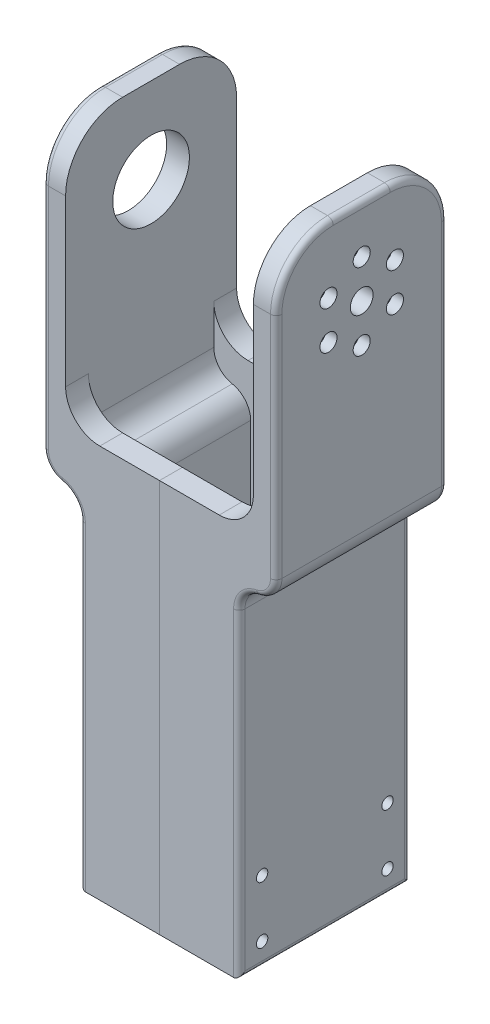
from build123d import *

# Parameters (mm, degrees)
SKETCH_1_W          = 60
SKETCH_1_H          = 100
EXTRUDE_1_DEPTH     = 8
SKETCH_2_R          = 13.45
CUT_EXTRUDE_1_DEPTH = 59.855755878
SKETCH_3_W          = 8
SKETCH_3_H          = 40
EXTRUDE_2_DEPTH     = 65.9
SKETCH_4_W          = 60
SKETCH_4_H          = 100
EXTRUDE_3_DEPTH     = 8
CUT_EXTRUDE_2_REACH = 102.537
SKETCH_10_R         = 4
SKETCH_10_R_2       = 1.6
SKETCH_15_R         = 18
EXTRUDE_4_DEPTH     = 9.8
SKETCH_12_R         = 3
CUT_EXTRUDE_4_DEPTH = 4
CUT_EXTRUDE_7_REACH = 102.537
SKETCH_10_2_R       = 4
SKETCH_10_2_R_2     = 1.6
SKETCH1_W           = 65.9
SKETCH1_H           = 30
CUT_EXTRUDE1_DEPTH  = 114.170711759
SKETCH2_W           = 8
SKETCH2_H           = 120
BOSS_EXTRUDE3_DEPTH = 60
FILLET1_R           = 12
FILLET3_R           = 8
FILLET4_R           = 8
BOSS_EXTRUDE4_REACH = 192.523
SKETCH3_W           = 8
SKETCH3_H           = 128
FILLET5_R           = 20
FILLET6_R           = 2
SKETCH7_R           = 2
CUT_EXTRUDE2_DEPTH  = 8
CUT_EXTRUDE3_START  = -48
SKETCH7_2_R         = 2
CUT_EXTRUDE3_DEPTH  = 8


with BuildPart() as part:
    # 草图1 → 凸台-拉伸1 (new body)
    with BuildSketch(Plane(origin=(0, 0, 0), x_dir=(0, 0, -1), z_dir=(1, 0, 0))):
        Rectangle(SKETCH_1_W, SKETCH_1_H)
    extrude(amount=EXTRUDE_1_DEPTH)

    # 草图2 → 切除-拉伸1 (cut, through all)
    with BuildSketch(Plane(origin=(8, 0, 0), x_dir=(0, 0, -1), z_dir=(1, 0, 0))):
        with Locations((0, 20)):
            Circle(SKETCH_2_R)
    extrude(amount=-CUT_EXTRUDE_1_DEPTH, mode=Mode.SUBTRACT)

    # 草图3 → 凸台-拉伸2 (add)
    with BuildSketch(Plane(origin=(8, 0, 0), x_dir=(0, 0, -1), z_dir=(1, 0, 0))):
        with Locations((-26, -30)):
            Rectangle(SKETCH_3_W, SKETCH_3_H)
        with Locations((26, -30)):
            Rectangle(SKETCH_3_W, SKETCH_3_H)
    extrude(amount=EXTRUDE_2_DEPTH)

    # 草图4 → 凸台-拉伸3 (add)
    with BuildSketch(Plane(origin=(73.9, 0, 0), x_dir=(0, 0, -1), z_dir=(1, 0, 0))):
        Rectangle(SKETCH_4_W, SKETCH_4_H)
    extrude(amount=EXTRUDE_3_DEPTH)

    # 草图10 → 切除-拉伸2 (cut, up to next)
    with BuildSketch(Plane(origin=(81.9, 0, 0), x_dir=(0, 0, -1), z_dir=(1, 0, 0)), mode=Mode.PRIVATE) as cut_extrude_2_sk1:
        with Locations((0, 20)):
            Circle(SKETCH_10_R)
    cut_extrude_2_tool1 = extrude(cut_extrude_2_sk1.sketch, amount=-CUT_EXTRUDE_2_REACH, mode=Mode.PRIVATE) & part.part
    # 草图10 → 切除-拉伸2 (cut, up to next)
    with BuildSketch(Plane(origin=(81.9, 0, 0), x_dir=(0, 0, -1), z_dir=(1, 0, 0)), mode=Mode.PRIVATE) as cut_extrude_2_sk2:
        with Locations((0, 33.5)):
            Circle(SKETCH_10_R_2)
    cut_extrude_2_tool2 = extrude(cut_extrude_2_sk2.sketch, amount=-CUT_EXTRUDE_2_REACH, mode=Mode.PRIVATE) & part.part
    # 草图10 → 切除-拉伸2 (cut, up to next)
    with BuildSketch(Plane(origin=(81.9, 0, 0), x_dir=(0, 0, -1), z_dir=(1, 0, 0)), mode=Mode.PRIVATE) as cut_extrude_2_sk3:
        with Locations((11.691342951, 26.75)):
            Circle(SKETCH_10_R_2)
    cut_extrude_2_tool3 = extrude(cut_extrude_2_sk3.sketch, amount=-CUT_EXTRUDE_2_REACH, mode=Mode.PRIVATE) & part.part
    # 草图10 → 切除-拉伸2 (cut, up to next)
    with BuildSketch(Plane(origin=(81.9, 0, 0), x_dir=(0, 0, -1), z_dir=(1, 0, 0)), mode=Mode.PRIVATE) as cut_extrude_2_sk4:
        with Locations((11.691342951, 13.25)):
            Circle(SKETCH_10_R_2)
    cut_extrude_2_tool4 = extrude(cut_extrude_2_sk4.sketch, amount=-CUT_EXTRUDE_2_REACH, mode=Mode.PRIVATE) & part.part
    # 草图10 → 切除-拉伸2 (cut, up to next)
    with BuildSketch(Plane(origin=(81.9, 0, 0), x_dir=(0, 0, -1), z_dir=(1, 0, 0)), mode=Mode.PRIVATE) as cut_extrude_2_sk5:
        with Locations((0, 6.5)):
            Circle(SKETCH_10_R_2)
    cut_extrude_2_tool5 = extrude(cut_extrude_2_sk5.sketch, amount=-CUT_EXTRUDE_2_REACH, mode=Mode.PRIVATE) & part.part
    # 草图10 → 切除-拉伸2 (cut, up to next)
    with BuildSketch(Plane(origin=(81.9, 0, 0), x_dir=(0, 0, -1), z_dir=(1, 0, 0)), mode=Mode.PRIVATE) as cut_extrude_2_sk6:
        with Locations((-11.691342951, 13.25)):
            Circle(SKETCH_10_R_2)
    cut_extrude_2_tool6 = extrude(cut_extrude_2_sk6.sketch, amount=-CUT_EXTRUDE_2_REACH, mode=Mode.PRIVATE) & part.part
    # 草图10 → 切除-拉伸2 (cut, up to next)
    with BuildSketch(Plane(origin=(81.9, 0, 0), x_dir=(0, 0, -1), z_dir=(1, 0, 0)), mode=Mode.PRIVATE) as cut_extrude_2_sk7:
        with Locations((-11.691342951, 26.75)):
            Circle(SKETCH_10_R_2)
    cut_extrude_2_tool7 = extrude(cut_extrude_2_sk7.sketch, amount=-CUT_EXTRUDE_2_REACH, mode=Mode.PRIVATE) & part.part
    add(cut_extrude_2_tool1.solids().sort_by_distance((81.9, 20, 0))[0], mode=Mode.SUBTRACT)
    add(cut_extrude_2_tool2.solids().sort_by_distance((81.9, 33.5, 0))[0], mode=Mode.SUBTRACT)
    add(cut_extrude_2_tool3.solids().sort_by_distance((81.9, 26.75, -11.691343))[0], mode=Mode.SUBTRACT)
    add(cut_extrude_2_tool4.solids().sort_by_distance((81.9, 13.25, -11.691343))[0], mode=Mode.SUBTRACT)
    add(cut_extrude_2_tool5.solids().sort_by_distance((81.9, 6.5, 0))[0], mode=Mode.SUBTRACT)
    add(cut_extrude_2_tool6.solids().sort_by_distance((81.9, 13.25, 11.691343))[0], mode=Mode.SUBTRACT)
    add(cut_extrude_2_tool7.solids().sort_by_distance((81.9, 26.75, 11.691343))[0], mode=Mode.SUBTRACT)

    # 草图15 → 凸台-拉伸4 (add)
    with BuildSketch(Plane.ZY.offset(-73.9)):
        with Locations(Location((0, 20, 0), (0, 0, 180))):
            Circle(SKETCH_15_R)
    extrude(amount=EXTRUDE_4_DEPTH)

    # 草图12 → 切除-拉伸4 (cut)
    with BuildSketch(Plane(origin=(81.9, 0, 0), x_dir=(0, 0, -1), z_dir=(1, 0, 0))):
        with Locations((0, 33.45)):
            Circle(SKETCH_12_R)
        with Locations((11.648041681, 26.725)):
            Circle(SKETCH_12_R)
        with Locations((11.648041681, 13.275)):
            Circle(SKETCH_12_R)
        with Locations((0, 6.55)):
            Circle(SKETCH_12_R)
        with Locations((-11.648041681, 13.275)):
            Circle(SKETCH_12_R)
        with Locations((-11.648041681, 26.725)):
            Circle(SKETCH_12_R)
    extrude(amount=-CUT_EXTRUDE_4_DEPTH, mode=Mode.SUBTRACT)

    # 草图10<2> → 切除-拉伸7 (cut, up to next)
    with BuildSketch(Plane(origin=(81.9, 0, 0), x_dir=(0, 0, -1), z_dir=(1, 0, 0)), mode=Mode.PRIVATE) as cut_extrude_7_sk1:
        with Locations((0, 20)):
            Circle(SKETCH_10_2_R)
    cut_extrude_7_tool1 = extrude(cut_extrude_7_sk1.sketch, amount=-CUT_EXTRUDE_7_REACH, mode=Mode.PRIVATE) & part.part
    # 草图10<2> → 切除-拉伸7 (cut, up to next)
    with BuildSketch(Plane(origin=(81.9, 0, 0), x_dir=(0, 0, -1), z_dir=(1, 0, 0)), mode=Mode.PRIVATE) as cut_extrude_7_sk2:
        with Locations((0, 33.5)):
            Circle(SKETCH_10_2_R_2)
    cut_extrude_7_tool2 = extrude(cut_extrude_7_sk2.sketch, amount=-CUT_EXTRUDE_7_REACH, mode=Mode.PRIVATE) & part.part
    # 草图10<2> → 切除-拉伸7 (cut, up to next)
    with BuildSketch(Plane(origin=(81.9, 0, 0), x_dir=(0, 0, -1), z_dir=(1, 0, 0)), mode=Mode.PRIVATE) as cut_extrude_7_sk3:
        with Locations((11.691342951, 26.75)):
            Circle(SKETCH_10_2_R_2)
    cut_extrude_7_tool3 = extrude(cut_extrude_7_sk3.sketch, amount=-CUT_EXTRUDE_7_REACH, mode=Mode.PRIVATE) & part.part
    # 草图10<2> → 切除-拉伸7 (cut, up to next)
    with BuildSketch(Plane(origin=(81.9, 0, 0), x_dir=(0, 0, -1), z_dir=(1, 0, 0)), mode=Mode.PRIVATE) as cut_extrude_7_sk4:
        with Locations((11.691342951, 13.25)):
            Circle(SKETCH_10_2_R_2)
    cut_extrude_7_tool4 = extrude(cut_extrude_7_sk4.sketch, amount=-CUT_EXTRUDE_7_REACH, mode=Mode.PRIVATE) & part.part
    # 草图10<2> → 切除-拉伸7 (cut, up to next)
    with BuildSketch(Plane(origin=(81.9, 0, 0), x_dir=(0, 0, -1), z_dir=(1, 0, 0)), mode=Mode.PRIVATE) as cut_extrude_7_sk5:
        with Locations((0, 6.5)):
            Circle(SKETCH_10_2_R_2)
    cut_extrude_7_tool5 = extrude(cut_extrude_7_sk5.sketch, amount=-CUT_EXTRUDE_7_REACH, mode=Mode.PRIVATE) & part.part
    # 草图10<2> → 切除-拉伸7 (cut, up to next)
    with BuildSketch(Plane(origin=(81.9, 0, 0), x_dir=(0, 0, -1), z_dir=(1, 0, 0)), mode=Mode.PRIVATE) as cut_extrude_7_sk6:
        with Locations((-11.691342951, 13.25)):
            Circle(SKETCH_10_2_R_2)
    cut_extrude_7_tool6 = extrude(cut_extrude_7_sk6.sketch, amount=-CUT_EXTRUDE_7_REACH, mode=Mode.PRIVATE) & part.part
    # 草图10<2> → 切除-拉伸7 (cut, up to next)
    with BuildSketch(Plane(origin=(81.9, 0, 0), x_dir=(0, 0, -1), z_dir=(1, 0, 0)), mode=Mode.PRIVATE) as cut_extrude_7_sk7:
        with Locations((-11.691342951, 26.75)):
            Circle(SKETCH_10_2_R_2)
    cut_extrude_7_tool7 = extrude(cut_extrude_7_sk7.sketch, amount=-CUT_EXTRUDE_7_REACH, mode=Mode.PRIVATE) & part.part
    add(cut_extrude_7_tool1.solids().sort_by_distance((81.9, 20, 0))[0], mode=Mode.SUBTRACT)
    add(cut_extrude_7_tool2.solids().sort_by_distance((81.9, 33.5, 0))[0], mode=Mode.SUBTRACT)
    add(cut_extrude_7_tool3.solids().sort_by_distance((81.9, 26.75, -11.691343))[0], mode=Mode.SUBTRACT)
    add(cut_extrude_7_tool4.solids().sort_by_distance((81.9, 13.25, -11.691343))[0], mode=Mode.SUBTRACT)
    add(cut_extrude_7_tool5.solids().sort_by_distance((81.9, 6.5, 0))[0], mode=Mode.SUBTRACT)
    add(cut_extrude_7_tool6.solids().sort_by_distance((81.9, 13.25, 11.691343))[0], mode=Mode.SUBTRACT)
    add(cut_extrude_7_tool7.solids().sort_by_distance((81.9, 26.75, 11.691343))[0], mode=Mode.SUBTRACT)

    # Sketch1 → Cut-Extrude1 (cut, through all)
    with BuildSketch(Plane(origin=(0, 0, -30), x_dir=(-1, 0, 0), z_dir=(0, 0, -1))):
        with Locations((-40.95, -25)):
            Rectangle(SKETCH1_W, SKETCH1_H)
    extrude(amount=-CUT_EXTRUDE1_DEPTH, mode=Mode.SUBTRACT)

    # Sketch2 → Boss-Extrude3 (add)
    with BuildSketch(Plane.XY.offset(30)):
        with Locations((16.95, -118)):
            Rectangle(SKETCH2_W, SKETCH2_H)
        Polygon((0, -58), (12.95, -58), (20.95, -58), (20.95, -50), (0, -50), align=None)
        with Locations((64.95, -118)):
            Rectangle(SKETCH2_W, SKETCH2_H)
        Polygon((81.9, -50), (60.95, -50), (60.95, -58), (68.95, -58), (81.9, -58), align=None)
    extrude(amount=-BOSS_EXTRUDE3_DEPTH)

    # Fillet1
    fillet1_edges = [part.edges().sort_by_distance(p)[0] for p in [
        (73.9, -40, 26),
        (73.9, -40, -26),
        (8, -40, 26),
        (8, -40, -26),
    ]]
    fillet(fillet1_edges, radius=FILLET1_R)

    # Fillet3
    fillet3_edges = [part.edges().sort_by_distance(p)[0] for p in [
        (8, -50, 0),
        (12.95, -58, 0),
        (68.95, -58, 0),
        (73.9, -50, 0),
    ]]
    fillet(fillet3_edges, radius=FILLET3_R)

    # Fillet4
    # the kernel refuses this fillet: 8 mm, written as the material it adds along each edge
    # the kernel refuses this fillet: 8 mm, written as the material it takes off along each edge
    with BuildSketch(Plane(origin=(20.95, -50, 22), x_dir=(0, -1, 0), z_dir=(0, 0, -1))) as fillet4_2_piece_1:
        with BuildLine():
            CenterArc((7.70660689, 8), FILLET4_R, 190.989260723, 79.010739277)
            Line((-0.146696555, 6.475), (-0.932026899, 6.3225))
            ThreePointArc((-0.932026899, 6.3225), (-0.8, 4.95), (-0.8, 0))
            Line((-0.8, 0), (0, -0.8))
            Line((0, -0.8), (7.70660689, -0.8))
            Line((7.70660689, -0.8), (7.70660689, 0))
        make_face()
    extrude(amount=44, mode=Mode.SUBTRACT)
    with BuildSketch(Plane(origin=(60.95, -50, 22), x_dir=(0, -1, 0), z_dir=(0, 0, -1))) as fillet4_2_piece_2:
        with BuildLine():
            CenterArc((7.70660689, -8), FILLET4_R, 90, 79.010739277)
            Line((-0.146696555, -6.475), (-0.932026899, -6.3225))
            ThreePointArc((-0.932026899, -6.3225), (-0.8, -4.95), (-0.8, 0))
            Line((-0.8, 0), (0, 0.8))
            Line((0, 0.8), (7.70660689, 0.8))
            Line((7.70660689, 0.8), (7.70660689, 0))
        make_face()
    extrude(amount=44, mode=Mode.SUBTRACT)
    with BuildSketch(Plane(origin=(81.9, -58, 49.266517225), x_dir=(0, 1, 0), z_dir=(0, 0, -1))) as fillet4_2_piece_3:
        with BuildLine():
            CenterArc((7.70660689, -8), FILLET4_R, 90, 79.010739277)
            Line((-0.146696555, -6.475), (-0.932026899, -6.3225))
            ThreePointArc((-0.932026899, -6.3225), (-0.8, -4.95), (-0.8, 0))
            Line((-0.8, 0), (0, 0.8))
            Line((0, 0.8), (7.70660689, 0.8))
            Line((7.70660689, 0.8), (7.70660689, 0))
        make_face()
    extrude(amount=98.53303445, mode=Mode.SUBTRACT)
    with BuildSketch(Plane(origin=(0, -58, 49.266517225), x_dir=(0.999743455245202, -0.02265002636609405, 0), z_dir=(0, 0, -1))) as fillet4_2_piece_4:
        with BuildLine():
            CenterArc((7.823392793, -7.885830011), FILLET4_R, 99.691398818, 79.010739277)
            Line((-0.174554849, -7.704629801), (-0.974349613, -7.686509779))
            Line((-0.974349613, -7.686509779), (-0.799794764, 0.018120021))
            Line((-0.799794764, 0.018120021), (0.018120021, 0.799794764))
            ThreePointArc((0.018120021, 0.799794764), (4.966850125, 0.687677134), (6.34198843, 0.788583001))
            Line((6.34198843, 0.788583001), (6.476661554, 0))
        make_face()
    extrude(amount=98.53303445, mode=Mode.SUBTRACT)

    # Sketch3 → Boss-Extrude4 (add, up to next)
    with BuildSketch(Plane(origin=(20.95, 0, 0), x_dir=(0, 0, -1), z_dir=(1, 0, 0)), mode=Mode.PRIVATE) as boss_extrude4_sk1:
        with Locations((-26, -114)):
            Rectangle(SKETCH3_W, SKETCH3_H)
    boss_extrude4_tool1 = extrude(boss_extrude4_sk1.sketch, amount=BOSS_EXTRUDE4_REACH, mode=Mode.PRIVATE) - part.part
    # Sketch3 → Boss-Extrude4 (add, up to next)
    with BuildSketch(Plane(origin=(20.95, 0, 0), x_dir=(0, 0, -1), z_dir=(1, 0, 0)), mode=Mode.PRIVATE) as boss_extrude4_sk2:
        with Locations((26, -114)):
            Rectangle(SKETCH3_W, SKETCH3_H)
    boss_extrude4_tool2 = extrude(boss_extrude4_sk2.sketch, amount=BOSS_EXTRUDE4_REACH, mode=Mode.PRIVATE) - part.part
    add(boss_extrude4_tool1.solids().sort_by_distance((20.95, -114, 26))[0])
    add(boss_extrude4_tool2.solids().sort_by_distance((20.95, -114, -26))[0])

    # Fillet5
    fillet5_edges = [part.edges().sort_by_distance(p)[0] for p in [
        (77.9, 50, 30),
        (77.9, 50, -30),
        (4, 50, 30),
        (4, 50, -30),
    ]]
    fillet(fillet5_edges, radius=FILLET5_R)

    # Fillet6
    fillet6_edges = [part.edges().sort_by_distance(p)[0] for p in [
        (12.95, -178, 0),
        (12.95, -122, -30),
        (68.95, -178, 0),
        (68.95, -122, -30),
        (68.95, -122, 30),
        (12.95, -122, 30),
        (70.777480255, -60.91079574, 30),
        (11.122519745, -60.91079574, -30),
        (70.777480255, -60.91079574, -30),
        (11.122519745, -60.91079574, 30),
        (1.827480255, -55.38259737, 30),
        (80.072519745, -55.38259737, 30),
        (81.9, -10.146696555, -30),
        (0, -10.146696555, -30),
        (1.827480255, -55.38259737, -30),
        (80.072519745, -55.38259737, -30),
        (81.9, -10.146696555, 30),
        (0, -10.146696555, 30),
        (81.9, 50, 0),
        (81.9, 44.142135624, -24.142135624),
        (81.9, 44.142135624, 24.142135624),
        (0, 50, 0),
        (0, 44.142135624, -24.142135624),
        (0, 44.142135624, 24.142135624),
    ]]
    fillet(fillet6_edges, radius=FILLET6_R)

    # Sketch7 → Cut-Extrude2 (cut)
    with BuildSketch(Plane(origin=(68.95, 0, 0), x_dir=(0, 0, -1), z_dir=(1, 0, 0))):
        with Locations(Location((-22, -150, 0), (0, 0, 90))):
            Circle(SKETCH7_R)
        with Locations(Location((22, -150, 0), (0, 0, 270))):
            Circle(SKETCH7_R)
        with Locations(Location((22, -170, 0), (0, 0, 90))):
            Circle(SKETCH7_R)
        with Locations(Location((-22, -170, 0), (0, 0, 270))):
            Circle(SKETCH7_R)
    extrude(amount=-CUT_EXTRUDE2_DEPTH, mode=Mode.SUBTRACT)

    # Sketch7<2> → Cut-Extrude3 (cut)
    with BuildSketch(Plane(origin=(68.95, 0, 0), x_dir=(0, 0, -1), z_dir=(1, 0, 0)).offset(CUT_EXTRUDE3_START)):
        with Locations(Location((-22, -150, 0), (0, 0, 90))):
            Circle(SKETCH7_2_R)
        with Locations(Location((22, -150, 0), (0, 0, 270))):
            Circle(SKETCH7_2_R)
        with Locations(Location((22, -170, 0), (0, 0, 90))):
            Circle(SKETCH7_2_R)
        with Locations(Location((-22, -170, 0), (0, 0, 270))):
            Circle(SKETCH7_2_R)
    extrude(amount=-CUT_EXTRUDE3_DEPTH, mode=Mode.SUBTRACT)


with BuildPart() as body_2:
    # Split Bodies 1: the piece on the far side of the plane
    add(part.part)
    split(bisect_by=Plane(origin=(40.95, 0, 0), x_dir=(0, 0, 1), z_dir=(1, 0, 0)), keep=Keep.BOTTOM)


with BuildPart() as part_1:
    add(part.part)

    # Split Bodies 1
    split(bisect_by=Plane(origin=(40.95, 0, 0), x_dir=(0, 0, 1), z_dir=(1, 0, 0)), keep=Keep.TOP)


solid = Compound([body_2.part, part_1.part])
